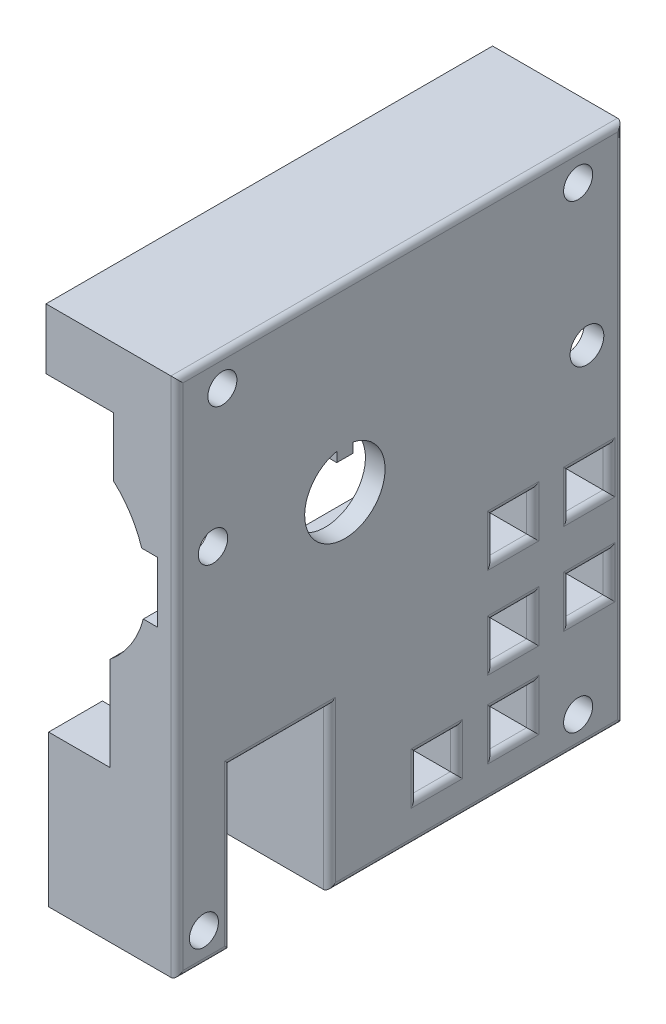
from build123d import *

# Parameters (mm, degrees)
PROFILEEXTRUDE_DEPTH = 73.76
HOSEWINDOW_W         = 16.29
HOSEWINDOW_H         = 26.5
HOSEWINDOWCUT_DEPTH  = 97.672784203
CAGESCREWS_R         = 2.4
CAGESCREWSCUT_DEPTH  = 97.672784203
AXLEHOLECUT_DEPTH    = 97.672784203
SETSCREWS_R          = 2.426338021
SETSCREWS_R_2        = 2.788762315
SETSCREWSCUT_DEPTH   = 97.67278428
SKETCH1_W            = 6.5
SKETCH1_H            = 6.5
CUT_EXTRUDE1_DEPTH   = 97.67278428
FILLET1_R            = 1


with BuildPart() as part:
    # Profile → ProfileExtrude (new body)
    with BuildSketch(Plane.XY):
        with BuildLine():
            Line((-6.01073477, -58.62791746), (-6.01073477, -33.62791746))
            Line((-6.01073477, -33.62791746), (4.13926523, -33.62791746))
            Line((4.13926523, -33.62791746), (4.13926523, -18.13791746))
            ThreePointArc((4.13926523, -18.13791746), (7.563334043, -14.326029686), (9.63126523, -9.63791746))
            Line((9.63126523, -9.63791746), (11.94926523, -9.63791746))
            Line((11.94926523, -9.63791746), (11.94926523, 0.36208254))
            Line((11.94926523, 0.36208254), (9.35926523, 0.36208254))
            ThreePointArc((9.35926523, 0.36208254), (7.525939238, 4.313848402), (4.70926523, 7.63708254))
            Line((4.70926523, 7.63708254), (4.70926523, 17.41208254))
            Line((4.70926523, 17.41208254), (-6.44073477, 17.41208254))
            Line((-6.44073477, 17.41208254), (-6.44073477, 27.41208254))
            Line((-6.44073477, 27.41208254), (15.18926523, 27.41208254))
            Line((15.18926523, 27.41208254), (15.18926523, -58.62791746))
            Line((15.18926523, -58.62791746), (-6.01073477, -58.62791746))
        make_face()
    extrude(amount=PROFILEEXTRUDE_DEPTH)

    # HoseWindow → HoseWindowCut (cut, through all)
    with BuildSketch(Plane(origin=(15.18926523, 0, 0), x_dir=(0, 0, -1), z_dir=(1, 0, 0))):
        with Locations((-56.725, -45.37791746)):
            Rectangle(HOSEWINDOW_W, HOSEWINDOW_H)
    extrude(amount=-HOSEWINDOWCUT_DEPTH, mode=Mode.SUBTRACT)

    # CageScrews → CageScrewsCut (cut, through all)
    with BuildSketch(Plane(origin=(15.18926523, 0, 0), x_dir=(0, 0, -1), z_dir=(1, 0, 0))):
        with Locations((-66.26, 22.41208254)):
            Circle(CAGESCREWS_R)
        with Locations((-7.5, 22.41208254)):
            Circle(CAGESCREWS_R)
        with Locations((-7.5, -53.62791746)):
            Circle(CAGESCREWS_R)
        with Locations((-69.31, -53.62791746)):
            Circle(CAGESCREWS_R)
    extrude(amount=-CAGESCREWSCUT_DEPTH, mode=Mode.SUBTRACT)

    # AxleHole → AxleHoleCut (cut, through all)
    with BuildSketch(Plane(origin=(15.18926523, 0, 0), x_dir=(0, 0, -1), z_dir=(1, 0, 0))):
        with BuildLine():
            Line((-44.699, 2.307293484), (-47.361, 2.307293484))
            Line((-47.361, 2.307293484), (-47.361, 3.926293484))
            ThreePointArc((-47.361, 3.926293484), (-46.03, -9.21691746), (-44.699, 3.926293484))
            Line((-44.699, 3.926293484), (-44.699, 2.307293484))
        make_face()
    extrude(amount=-AXLEHOLECUT_DEPTH, mode=Mode.SUBTRACT)

    # SetScrews → SetScrewsCut (cut, through all)
    with BuildSketch(Plane(origin=(15.18926523, 0, 0), x_dir=(0, 0, -1), z_dir=(1, 0, 0))):
        with Locations((-67.80722939, 0.544946624)):
            Circle(SETSCREWS_R)
        with Locations((-6.04299884, -1.55824191)):
            Circle(SETSCREWS_R_2)
    extrude(amount=-SETSCREWSCUT_DEPTH, mode=Mode.SUBTRACT)

    # Sketch1 → Cut-Extrude1 (cut, through all)
    with BuildSketch(Plane(origin=(15.18926523, 0, 0), x_dir=(0, 0, -1), z_dir=(1, 0, 0))):
        with Locations((-18.25, -49.02791746)):
            Rectangle(SKETCH1_W, SKETCH1_H)
        with Locations((-30.85, -49.02791746)):
            Rectangle(SKETCH1_W, SKETCH1_H)
        with Locations((-5.65, -36.32791746)):
            Rectangle(SKETCH1_W, SKETCH1_H)
        with Locations((-18.25, -36.32791746)):
            Rectangle(SKETCH1_W, SKETCH1_H)
        with Locations((-5.65, -21.32791746)):
            Rectangle(SKETCH1_W, SKETCH1_H)
        with Locations((-18.25, -21.32791746)):
            Rectangle(SKETCH1_W, SKETCH1_H)
    extrude(amount=-CUT_EXTRUDE1_DEPTH, mode=Mode.SUBTRACT)

    # Fillet1
    fillet1_edges = [part.edges().sort_by_distance(p)[0] for p in [
        (15.18926523, -49.02791746, 21.5),
        (15.18926523, -52.27791746, 18.25),
        (15.18926523, -49.02791746, 15),
        (15.18926523, -45.77791746, 18.25),
        (15.18926523, -58.62791746, 69.315),
        (15.18926523, -45.37791746, 64.87),
        (15.18926523, -32.12791746, 56.725),
        (15.18926523, -45.37791746, 48.58),
        (15.18926523, -58.62791746, 24.29),
        (15.18926523, -15.60791746, 0),
        (15.18926523, 27.41208254, 36.88),
        (15.18926523, -15.60791746, 73.76),
        (15.18926523, -24.57791746, 5.65),
        (15.18926523, -21.32791746, 2.4),
        (15.18926523, -18.07791746, 5.65),
        (15.18926523, -21.32791746, 8.9),
        (15.18926523, -21.32791746, 15),
        (15.18926523, -18.07791746, 18.25),
        (15.18926523, -21.32791746, 21.5),
        (15.18926523, -24.57791746, 18.25),
        (15.18926523, -39.57791746, 5.65),
        (15.18926523, -36.32791746, 2.4),
        (15.18926523, -33.07791746, 5.65),
        (15.18926523, -36.32791746, 8.9),
        (15.18926523, -36.32791746, 15),
        (15.18926523, -33.07791746, 18.25),
        (15.18926523, -36.32791746, 21.5),
        (15.18926523, -39.57791746, 18.25),
        (15.18926523, -52.27791746, 30.85),
        (15.18926523, -49.02791746, 27.6),
        (15.18926523, -45.77791746, 30.85),
        (15.18926523, -49.02791746, 34.1),
    ]]
    fillet(fillet1_edges, radius=FILLET1_R)


solid = part.part
